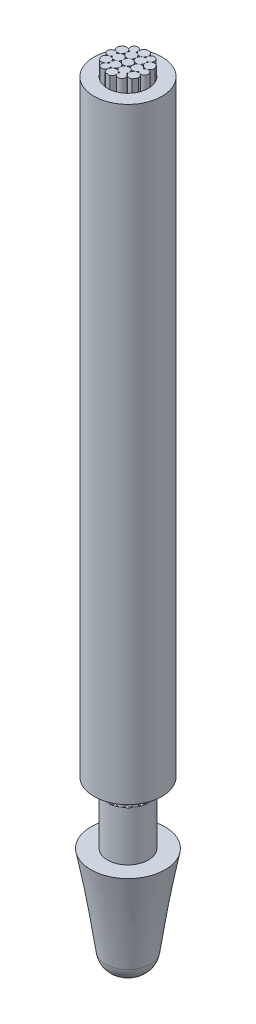
from build123d import *

# Parameters (mm, degrees)
EXTRUDE_2_OUTLINE_R  = 0.075
EXTRUDE_2_DEPTH      = 10.2
EXTRUDE_2_2_DEPTH    = 10.2
EXTRUDE_2_3_DEPTH    = 10.2
EXTRUDE_2_4_DEPTH    = 10.2
EXTRUDE_2_5_DEPTH    = 10.2
EXTRUDE_2_6_DEPTH    = 10.2
EXTRUDE_2_7_DEPTH    = 10.2
EXTRUDE_2_8_DEPTH    = 10.2
EXTRUDE_2_9_DEPTH    = 10.2
EXTRUDE_2_10_DEPTH   = 10.2
EXTRUDE_2_11_DEPTH   = 10.2
EXTRUDE_2_12_DEPTH   = 10.2
EXTRUDE_2_13_DEPTH   = 10.2
EXTRUDE_5_DEPTH      = 2.5
EXTRUDE_6_DEPTH      = 9
EXTRUDE_6_DEPTH_BACK = 0.8
EXTRUDE_6_START      = 1
SKETCH_3_R           = 0.55
SKETCH_3_R_2         = 0.33
FILLET_3_R           = 0.3


# Read off the part's stored shape, not the designer's step: Бобышка-Вытянуть2
with BuildPart() as part:
    # Бобышка-Вытянуть2 outline → Бобышка-Вытянуть2 (new body)
    with BuildSketch(Plane(origin=(0, 0, 0), x_dir=(1, 0, 0), z_dir=(0, 1, 0))):
        Circle(EXTRUDE_2_OUTLINE_R)
    extrude(amount=EXTRUDE_2_DEPTH)


with BuildPart() as body_2:
    # Extrude 2 2 outline → Extrude 2 2 (new body)
    with BuildSketch(Plane(origin=(0, 0, 0), x_dir=(1, 0, 0), z_dir=(0, 1, 0))):
        with BuildLine():
            ThreePointArc((-0.215577435, 0.031523255), (-0.329990207, -0.00229018), (-0.215577435, -0.036103616))
            ThreePointArc((-0.215577435, -0.036103616), (-0.135616584, -0.076152155), (-0.074161469, -0.011183762))
            ThreePointArc((-0.074161469, -0.011183762), (-0.074991098, -0.00115549), (-0.074470828, 0.008893581))
            ThreePointArc((-0.074470828, 0.008893581), (-0.136756085, 0.071763554), (-0.215577435, 0.031523255))
        make_face()
    extrude(amount=EXTRUDE_2_2_DEPTH)



with BuildPart() as body_3:
    # Extrude 2 3 outline → Extrude 2 3 (new body)
    with BuildSketch(Plane(origin=(0, 0, 0), x_dir=(1, 0, 0), z_dir=(0, 1, 0))):
        with BuildLine():
            ThreePointArc((-0.078416857, 0.202460861), (-0.164965898, 0.285808068), (-0.13605962, 0.169180796))
            ThreePointArc((-0.13605962, 0.169180796), (-0.132931564, 0.081694169), (-0.049012134, 0.056769805))
            ThreePointArc((-0.049012134, 0.056769805), (-0.03748264, 0.064961925), (-0.024620163, 0.070843825))
            ThreePointArc((-0.024620163, 0.070843825), (-0.004207657, 0.155990018), (-0.078416857, 0.202460861))
        make_face()
    extrude(amount=EXTRUDE_2_3_DEPTH)


with BuildPart() as body_4:
    # Extrude 2 4 outline → Extrude 2 4 (new body)
    with BuildSketch(Plane(origin=(0, 0, 0), x_dir=(1, 0, 0), z_dir=(0, 1, 0))):
        with BuildLine():
            ThreePointArc((0.139140572, 0.168657106), (0.167012389, 0.284614831), (0.080525962, 0.202498267))
            ThreePointArc((0.080525962, 0.202498267), (0.006248792, 0.154228257), (0.029790206, 0.068829817))
            ThreePointArc((0.029790206, 0.068829817), (0.038512817, 0.06435653), (0.046577497, 0.058783813))
            ThreePointArc((0.046577497, 0.058783813), (0.133726217, 0.079291783), (0.139140572, 0.168657106))
        make_face()
    extrude(amount=EXTRUDE_2_4_DEPTH)


with BuildPart() as body_5:
    # Extrude 2 5 outline → Extrude 2 5 (new body)
    with BuildSketch(Plane(origin=(0, 0, 0), x_dir=(1, 0, 0), z_dir=(0, 1, 0))):
        with BuildLine():
            ThreePointArc((0.217749972, -0.037195687), (0.329990231, -0.002290181), (0.217749972, 0.032615326))
            ThreePointArc((0.217749972, 0.032615326), (0.076367703, -0.00229018), (0.217749972, -0.037195687))
        make_face()
    extrude(amount=EXTRUDE_2_5_DEPTH)


with BuildPart() as body_6:
    # Extrude 2 6 outline → Extrude 2 6 (new body)
    with BuildSketch(Plane(origin=(0, 0, 0), x_dir=(1, 0, 0), z_dir=(0, 1, 0))):
        with BuildLine():
            ThreePointArc((0.078601287, -0.207160724), (0.164936529, -0.285825011), (0.140123873, -0.171692736))
            ThreePointArc((0.140123873, -0.171692736), (0.038908974, -0.067218275), (0.078601287, -0.207160724))
        make_face()
    extrude(amount=EXTRUDE_2_6_DEPTH)


with BuildPart() as body_7:
    # Extrude 2 7 outline → Extrude 2 7 (new body)
    with BuildSketch(Plane(origin=(0, 0, 0), x_dir=(1, 0, 0), z_dir=(0, 1, 0))):
        with BuildLine():
            ThreePointArc((-0.137069196, -0.172203487), (-0.162882691, -0.286998397), (-0.076471576, -0.207140228))
            ThreePointArc((-0.076471576, -0.207140228), (-0.036171958, -0.067219203), (-0.137069196, -0.172203487))
        make_face()
    extrude(amount=EXTRUDE_2_7_DEPTH)


with BuildPart() as body_8:
    # Extrude 2 8 outline → Extrude 2 8 (new body)
    with BuildSketch(Plane(origin=(0, 0, 0), x_dir=(1, 0, 0), z_dir=(0, 1, 0))):
        with BuildLine():
            ThreePointArc((-0.296729349, 0.144401155), (-0.158491958, 0.090441918), (-0.275270897, 0.182005311))
            ThreePointArc((-0.275270897, 0.182005311), (-0.286617495, 0.163555531), (-0.296729349, 0.144401155))
        make_face()
    extrude(amount=EXTRUDE_2_8_DEPTH)


with BuildPart() as body_9:
    # Extrude 2 9 outline → Extrude 2 9 (new body)
    with BuildSketch(Plane(origin=(0, 0, 0), x_dir=(1, 0, 0), z_dir=(0, 1, 0))):
        with BuildLine():
            ThreePointArc((-0.267830407, -0.192787118), (-0.159068831, -0.0940291), (-0.29802696, -0.141703673))
            ThreePointArc((-0.29802696, -0.141703673), (-0.284079249, -0.16792552), (-0.267830407, -0.192787118))
        make_face()
    extrude(amount=EXTRUDE_2_9_DEPTH)


with BuildPart() as body_10:
    # Extrude 2 10 outline → Extrude 2 10 (new body)
    with BuildSketch(Plane(origin=(0, 0, 0), x_dir=(1, 0, 0), z_dir=(0, 1, 0))):
        with BuildLine():
            ThreePointArc((-0.020066658, 0.329389328), (0.000969374, 0.182518498), (0.023564272, 0.329157599))
            ThreePointArc((0.023564272, 0.329157599), (0.001752641, 0.329995346), (-0.020066658, 0.329389328))
        make_face()
    extrude(amount=EXTRUDE_2_10_DEPTH)


with BuildPart() as body_11:
    # Extrude 2 11 outline → Extrude 2 11 (new body)
    with BuildSketch(Plane(origin=(0, 0, 0), x_dir=(1, 0, 0), z_dir=(0, 1, 0))):
        with BuildLine():
            ThreePointArc((0.038848965, -0.327705291), (0.000977296, -0.187743587), (-0.03543522, -0.328091977))
            ThreePointArc((-0.03543522, -0.328091977), (0.001717788, -0.329995529), (0.038848965, -0.327705291))
        make_face()
    extrude(amount=EXTRUDE_2_11_DEPTH)


with BuildPart() as body_12:
    # Extrude 2 12 outline → Extrude 2 12 (new body)
    with BuildSketch(Plane(origin=(0, 0, 0), x_dir=(1, 0, 0), z_dir=(0, 1, 0))):
        with BuildLine():
            ThreePointArc((0.301331175, -0.134534467), (0.161602494, -0.094372467), (0.265242363, -0.196332597))
            ThreePointArc((0.265242363, -0.196332597), (0.284966921, -0.166414705), (0.301331175, -0.134534467))
        make_face()
    extrude(amount=EXTRUDE_2_12_DEPTH)


with BuildPart() as body_13:
    # Extrude 2 13 outline → Extrude 2 13 (new body)
    with BuildSketch(Plane(origin=(0, 0, 0), x_dir=(1, 0, 0), z_dir=(0, 1, 0))):
        with BuildLine():
            ThreePointArc((0.271600665, 0.1874382), (0.16103432, 0.090782272), (0.300968191, 0.135344552))
            ThreePointArc((0.300968191, 0.135344552), (0.287466887, 0.162057981), (0.271600665, 0.1874382))
        make_face()
    extrude(amount=EXTRUDE_2_13_DEPTH)


with BuildPart() as body_14:
    # Эскиз2 → Бобышка-Вытянуть5 (new body)
    with BuildSketch(Plane(origin=(0, 0, 0), x_dir=(1, 0, 0), z_dir=(0, 1, 0))):
        with BuildLine():
            ThreePointArc((-0.020066658, 0.329389328), (-0.165035087, 0.285768123), (-0.275270897, 0.182005311))
            ThreePointArc((-0.275270897, 0.182005311), (-0.286617495, 0.163555531), (-0.296729349, 0.144401155))
            ThreePointArc((-0.296729349, 0.144401155), (-0.329996606, 0.00149668), (-0.29802696, -0.141703673))
            ThreePointArc((-0.29802696, -0.141703673), (-0.284079249, -0.16792552), (-0.267830407, -0.192787118))
            ThreePointArc((-0.267830407, -0.192787118), (-0.166040241, -0.285185271), (-0.03543522, -0.328091977))
            ThreePointArc((-0.03543522, -0.328091977), (0.001717788, -0.329995529), (0.038848965, -0.327705291))
            ThreePointArc((0.038848965, -0.327705291), (0.165627836, -0.285424981), (0.265242363, -0.196332597))
            ThreePointArc((0.265242363, -0.196332597), (0.284966921, -0.166414705), (0.301331175, -0.134534467))
            ThreePointArc((0.301331175, -0.134534467), (0.322753225, -0.068777584), (0.33, 0))
            ThreePointArc((0.33, 0), (0.322660428, 0.069211621), (0.300968191, 0.135344552))
            ThreePointArc((0.300968191, 0.135344552), (0.287466887, 0.162057981), (0.271600665, 0.1874382))
            ThreePointArc((0.271600665, 0.1874382), (0.163712193, 0.28652804), (0.023564272, 0.329157599))
            ThreePointArc((0.023564272, 0.329157599), (0.001752641, 0.329995346), (-0.020066658, 0.329389328))
        make_face()
    extrude(amount=-EXTRUDE_5_DEPTH)

    # Эскиз5 → Повернуть1 (revolve)
    with BuildSketch(Plane(origin=(0, 0, 0), x_dir=(-1, 0, 0), z_dir=(0, 0, 1)), mode=Mode.PRIVATE) as revolve_1_sk:
        with BuildLine():
            Line((-0.33, 0.8), (-0.6, 0.8))
            add(Edge.make_bspline(
                [(-0.33, 2.501807797), (-0.435127833, 1.646013076), (-0.6, 0.8)],
                knots=[0, 0, 0, 1, 1, 1], degree=2))
            Line((-0.33, 2.501807797), (0, 2.501807797))
            Line((0, 2.501807797), (0, 0.8))
            Line((0, 0.8), (-0.33, 0.8))
        make_face()
    revolve(revolve_1_sk.sketch.rotate(Axis((0, -0.8, 0), (0, -1, 0)), 90), axis=Axis((0, -0.8, 0), (0, -1, 0)))

    # Скругление3
    fillet_3_edges = [body_14.edges().sort_by_distance(p)[0] for p in [
        (0, -2.501807797, -0.33),
    ]]
    fillet(fillet_3_edges, radius=FILLET_3_R)


with BuildPart() as body_2_1:
    add(body_2.part)

    add(body_3.part)  # Бобышка-Вытянуть6 merges body 3

    add(body_4.part)  # Бобышка-Вытянуть6 merges body 4

    add(body_5.part)  # Бобышка-Вытянуть6 merges body 5

    add(body_6.part)  # Бобышка-Вытянуть6 merges body 6

    add(body_7.part)  # Бобышка-Вытянуть6 merges body 7

    add(body_8.part)  # Бобышка-Вытянуть6 merges body 8

    add(body_9.part)  # Бобышка-Вытянуть6 merges body 9

    add(body_10.part)  # Бобышка-Вытянуть6 merges body 10

    add(body_11.part)  # Бобышка-Вытянуть6 merges body 11

    add(body_12.part)  # Бобышка-Вытянуть6 merges body 12

    add(body_13.part)  # Бобышка-Вытянуть6 merges body 13
    # Эскиз3 → Бобышка-Вытянуть6 (add, two sides: drawn at the far end of the back side and taken through both)
    with BuildSketch(Plane(origin=(0, 0, 0), x_dir=(1, 0, 0), z_dir=(0, 1, 0)).offset(EXTRUDE_6_START - EXTRUDE_6_DEPTH_BACK)):
        with Locations(Location((0, 0, 0), (0, 0, 270))):
            Circle(SKETCH_3_R)
        with Locations(Location((0, 0, 0), (0, 0, 270))):
            Circle(SKETCH_3_R_2, mode=Mode.SUBTRACT)
    extrude(amount=EXTRUDE_6_DEPTH + EXTRUDE_6_DEPTH_BACK)


solid = Compound([part.part, body_14.part, body_2_1.part])
